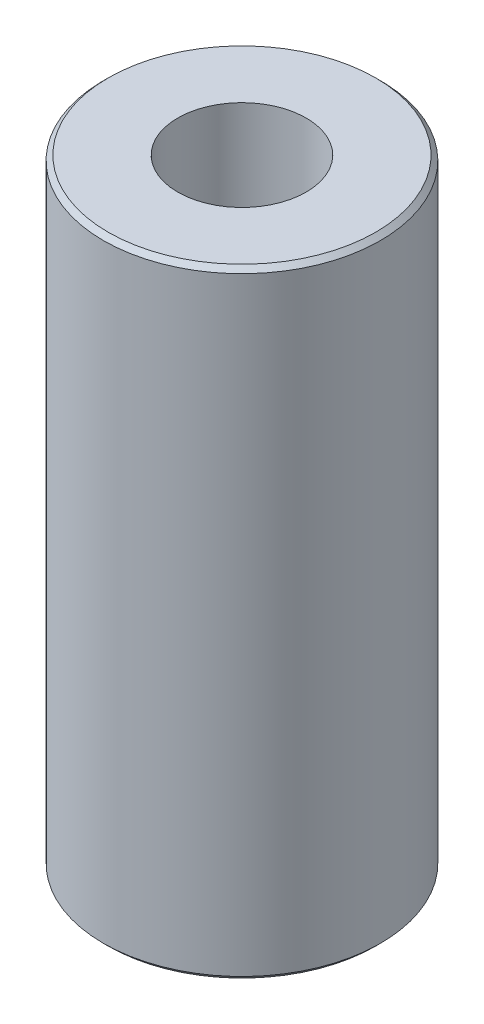
from build123d import *

# Parameters (mm, degrees)
SKETCH1_R           = 60
BOSS_EXTRUDE1_DEPTH = 267.789359422
SKETCH2_R           = 27.821419592
CUT_EXTRUDE1_DEPTH  = 281.911268944
CHAMFER1_SIZE       = 2.081373067


with BuildPart() as part:
    # Sketch1 → Boss-Extrude1 (new body)
    with BuildSketch(Plane(origin=(0, 0, 0), x_dir=(1, 0, 0), z_dir=(0, 1, 0))):
        Circle(SKETCH1_R)
    extrude(amount=BOSS_EXTRUDE1_DEPTH)

    # Sketch2 → Cut-Extrude1 (cut, through all)
    with BuildSketch(Plane(origin=(0, 0, 0), x_dir=(1, 0, 0), z_dir=(0, 1, 0))):
        Circle(SKETCH2_R)
    extrude(amount=CUT_EXTRUDE1_DEPTH, mode=Mode.SUBTRACT)

    # Chamfer1
    chamfer1_edges = [part.edges().sort_by_distance(p)[0] for p in [
        (-60, 267.789359422, 0),
        (-60, 0, 0),
    ]]
    chamfer(chamfer1_edges, length=CHAMFER1_SIZE)


solid = part.part
